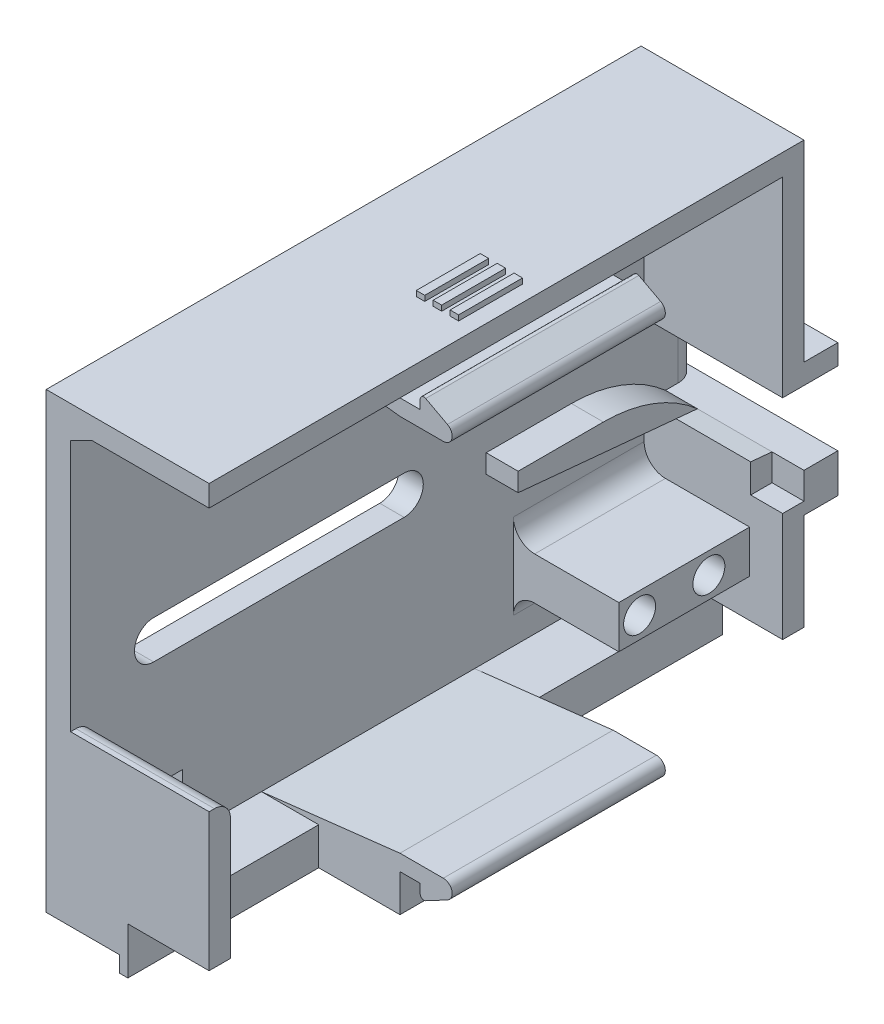
from build123d import *

# Parameters (mm, degrees)
MAIN_EXTRUDE_DEPTH            = 2.2875
WALLS_START                   = 2.2875
WALLS_DEPTH                   = 13
CORNER_SUPPORT_DEPTH          = 2
SKETCH2_R                     = 0.95
SKETCH2_W                     = 2.4
SKETCH2_H                     = 4
SKETCH2_W_2                   = 1
SWITCH_SPACER_DEPTH           = 9.9
ARM_SUPPORT_EXTRUDE_DEPTH     = 3
ARM_SUPPORT_CURVE_DEPTH       = 40.380356778
FILLET4_R                     = 2
FILLET3_R                     = 2
SKETCH2_5_R                   = 0.95
SWITCH_MOUNT_HOLES_DEPTH      = 40.380356889
SKETCH35_R                    = 1.5
SWITCH_MOUNT_EXIT_HOLES_DEPTH = 3
SKETCH4_W                     = 8.5
SKETCH4_H                     = 5.5
WIRE_HOLE_DEPTH               = 40.380356889
SKETCH25_W                    = 6
SKETCH25_H                    = 1.35
FEMALE_SNAP_DEPTH             = 10.125
SKETCH5_W                     = 30
SKETCH5_H                     = 12.75
SERVO_HOLE_DEPTH              = 40.380356889
MAGNET_EXTRUDE_1_DEPTH        = 7.625
MAGNET_EXTRUDE_1_DEPTH_BACK   = 8.2
SKETCH30_W                    = 15.7875
SKETCH30_H                    = 0.9
SKETCH30_W_2                  = 17.7875
SKETCH30_H_2                  = 1.5
SKETCH29_R                    = 7.7
MAGNET_HOLE_DEPTH             = 2.1
SKETCH31_R                    = 5.5
MAGNET_THRU_HOLE_DEPTH        = 58.632218961
SKETCH39_W                    = 3.175
SKETCH39_H                    = 12.55
CUT_EXTRUDE1_DEPTH            = 45.416158798
CUT_EXTRUDE2_DEPTH            = 42.895144408
BOSS_EXTRUDE2_DEPTH           = 10
MIRROR1_OUTLINE_W             = 42.5
MIRROR1_OUTLINE_H             = 55.825
MIRROR1_OUTLINE_W_2           = 5.5
MIRROR1_OUTLINE_H_2           = 8.5
MIRROR1_OUTLINE_R             = 0.95
MIRROR1_DEPTH                 = 2.2875
MIRROR1_START                 = 2.2875
MIRROR1_2_DEPTH               = 13
MIRROR1_3_OUTLINE_W           = 4
MIRROR1_3_OUTLINE_H           = 12.275
MIRROR1_3_OUTLINE_R           = 1.5
MIRROR1_3_DEPTH               = 9.9
MIRROR1_4_OUTLINE_R           = 1.5
MIRROR1_4_OUTLINE_R_2         = 0.95
MIRROR1_4_DEPTH               = 3
MIRROR1_START_2               = 5.2875
MIRROR1_5_OUTLINE_R           = 1.5
MIRROR1_5_OUTLINE_R_2         = 0.95
MIRROR1_5_DEPTH               = 3.9
MIRROR1_START_3               = 12.1875
MIRROR1_6_DEPTH               = 0.1
MIRROR1_START_4               = -84.325
MIRROR1_7_DEPTH               = 14.275
MIRROR1_START_5               = -30.5
MIRROR1_8_DEPTH               = 2
SKETCH6_W                     = 59
SKETCH6_H                     = 44
MIRROR_CUT_DEPTH              = 91.295353043
MALE_SNAP_DEPTH               = 10
SKETCH34_W                    = 55.825
SKETCH34_H                    = 1.5
MAGNET_EXTRUDE_DEPTH          = 8.4
SKETCH34_5_W                  = 15.9125
SKETCH34_5_H                  = 0.9
SKETCH34_5_W_2                = 17.9125
SKETCH34_5_H_2                = 1.5
MAGNET_BOTTOM_CUT_DEPTH       = 7.625
SKETCH36_W                    = 0.79375
SKETCH36_H                    = 6
BOSS_EXTRUDE1_DEPTH           = 0.5
BOSS_EXTRUDE5_DEPTH           = 3.175
FILLET7_R                     = 2


with BuildPart() as part:
    # Sketch1 → Main Extrude (new body)
    with BuildSketch(Plane(origin=(0, 0, 0), x_dir=(0, 0, -1), z_dir=(1, 0, 0))):
        Polygon((-30.5, -9.35), (-27.325, -9.35), (-27.325, -21.25), (28.5, -21.25), (28.5, 21.25), (-27.325, 21.25), (-27.325, 3.2), (-30.5, 3.2), align=None)
        with BuildLine():
            Line((20.7, -3.65), (-2.8, -3.65))
            ThreePointArc((-2.8, -3.65), (-4.6, -1.85), (-2.8, -0.05))
            Line((-2.8, -0.05), (20.7, -0.05))
            ThreePointArc((20.7, -0.05), (22.5, -1.85), (20.7, -3.65))
        make_face(mode=Mode.SUBTRACT)
    extrude(amount=MAIN_EXTRUDE_DEPTH)

    # Sketch1<3> → Walls (add)
    with BuildSketch(Plane(origin=(0, 0, 0), x_dir=(0, 0, -1), z_dir=(1, 0, 0)).offset(WALLS_START)):
        Polygon((-25.325, 19.25), (28.5, 19.25), (28.5, 21.25), (-27.325, 21.25), (-27.325, 3.2), (-30.5, 3.2), (-30.5, 1.3), (-25.325, 1.3), align=None)
        with BuildLine():
            Line((28.5, -5.425), (28, -5.425))
            ThreePointArc((28, -5.425), (26.939339828, -5.864339828), (26.5, -6.925))
            Line((26.5, -6.925), (26.5, -19.25))
            Line((26.5, -19.25), (-25.325, -19.25))
            Line((-25.325, -19.25), (-25.325, -8.1))
            Line((-25.325, -8.1), (-28.5, -8.1))
            Line((-28.5, -8.1), (-28.5, -4.45))
            Line((-28.5, -4.45), (-30.5, -4.45))
            Line((-30.5, -4.45), (-30.5, -9.35))
            Line((-30.5, -9.35), (-27.325, -9.35))
            Line((-27.325, -9.35), (-27.325, -21.25))
            Line((-27.325, -21.25), (28.5, -21.25))
            Line((28.5, -21.25), (28.5, -5.425))
        make_face()
    extrude(amount=WALLS_DEPTH)

    # Sketch22 → Corner Support (add)
    with BuildSketch(Plane(origin=(0, 0, -28.5), x_dir=(-1, 0, 0), z_dir=(0, 0, -1))):
        Polygon((-4.2875, 19.25), (-2.2875, 18.25), (-2.2875, 19.25), align=None)
    extrude(amount=-CORNER_SUPPORT_DEPTH)

    # Sketch2 → Switch Spacer (add)
    # profile 1 of 7: a face of its own
    with BuildSketch(Plane(origin=(2.2875, 0, 0), x_dir=(0, 0, -1), z_dir=(1, 0, 0))):
        Polygon((-14.05, -10.75), (-17.05, -10.75), (-17.05, -14.75), (-14.05, -14.75), (-14.05, -12.75), align=None)
        with Locations((-15, -12.75)):
            Circle(SKETCH2_R, mode=Mode.SUBTRACT)
    # profile 2 of 7: a face of its own
    with BuildSketch(Plane(origin=(2.2875, 0, 0), x_dir=(0, 0, -1), z_dir=(1, 0, 0))):
        with Locations((-15, -12.75)):
            Circle(SKETCH2_R)
    # profile 3 of 7: a face of its own
    with BuildSketch(Plane(origin=(2.2875, 0, 0), x_dir=(0, 0, -1), z_dir=(1, 0, 0))):
        Polygon((-19.45, -10.75), (-22.45, -10.75), (-22.45, -12.75), (-22.45, -14.75), (-19.45, -14.75), align=None)
        with BuildLine():
            ThreePointArc((-20.55, -12.75), (-21.5, -13.7), (-22.45, -12.75))
            ThreePointArc((-22.45, -12.75), (-21.5, -11.8), (-20.55, -12.75))
        make_face(mode=Mode.SUBTRACT)
    # profile 4 of 7: a face of its own
    with BuildSketch(Plane(origin=(2.2875, 0, 0), x_dir=(0, 0, -1), z_dir=(1, 0, 0))):
        with Locations((-21.5, -12.75)):
            Circle(SKETCH2_R)
    # profile 5 of 7: a face of its own
    with BuildSketch(Plane(origin=(2.2875, 0, 0), x_dir=(0, 0, -1), z_dir=(1, 0, 0))):
        Polygon((-22.45, -12.75), (-22.45, -10.75), (-25.325, -10.75), (-25.325, -14.75), (-22.45, -14.75), align=None)
    # profile 6 of 7: a face of its own
    with BuildSketch(Plane(origin=(2.2875, 0, 0), x_dir=(0, 0, -1), z_dir=(1, 0, 0))):
        with Locations((-18.25, -12.75)):
            Rectangle(SKETCH2_W, SKETCH2_H)
    # profile 7 of 7: a face of its own
    with BuildSketch(Plane(origin=(2.2875, 0, 0), x_dir=(0, 0, -1), z_dir=(1, 0, 0))):
        with Locations((-13.55, -12.75)):
            Rectangle(SKETCH2_W_2, SKETCH2_H)
    extrude(amount=SWITCH_SPACER_DEPTH)

    # Sketch3 → Arm Support Extrude (add)
    with BuildSketch(Plane(origin=(2.2875, 0, 0), x_dir=(0, 0, -1), z_dir=(1, 0, 0))):
        with BuildLine():
            Line((-18.5, -2.25), (-10.5, -2.25))
            Line((-10.5, -2.25), (-10.5, -4))
            Line((-10.5, -4), (-28.5, -5.7))
            Line((-28.5, -5.7), (-30.5, -5.7))
            ThreePointArc((-30.5, -5.7), (-24.743046131, -3.129622151), (-18.5, -2.25))
        make_face()
    extrude(amount=ARM_SUPPORT_EXTRUDE_DEPTH)

    # Sketch7 → Arm Support Curve (cut, through all)
    with BuildSketch(Plane(origin=(2.2875, 0, 0), x_dir=(0, 0, -1), z_dir=(1, 0, 0))):
        with BuildLine():
            Line((-28.5, -4.583410824), (-28.5, -4.45))
            Line((-28.5, -4.45), (-30.5, -4.45))
            Line((-30.5, -4.45), (-30.5, -5.7))
            ThreePointArc((-30.5, -5.7), (-29.627655409, -5.180138898), (-28.73283292, -4.7))
            ThreePointArc((-28.73283292, -4.7), (-28.616584416, -4.641369997), (-28.5, -4.583410824))
        make_face()
    extrude(amount=ARM_SUPPORT_CURVE_DEPTH, mode=Mode.SUBTRACT)

    # Fillet4
    fillet4_edges = [part.edges().sort_by_distance(p)[0] for p in [
        (2.2875, -2.2, 30.5),
    ]]
    fillet(fillet4_edges, radius=FILLET4_R)

    # Fillet3
    fillet3_edges = [part.edges().sort_by_distance(p)[0] for p in [
        (2.2875, -14.75, 19.1875),
        (2.2875, -10.75, 19.1875),
    ]]
    fillet(fillet3_edges, radius=FILLET3_R)

    # Sketch2<5> → Switch Mount Holes (cut, symmetric)
    with BuildSketch(Plane(origin=(2.2875, 0, 0), x_dir=(0, 0, -1), z_dir=(1, 0, 0))):
        with Locations((-21.5, -12.75)):
            Circle(SKETCH2_5_R)
        with Locations((-15, -12.75)):
            Circle(SKETCH2_5_R)
    extrude(amount=SWITCH_MOUNT_HOLES_DEPTH, both=True, mode=Mode.SUBTRACT)

    # Sketch35 → Switch Mount Exit Holes (cut)
    with BuildSketch(Plane(origin=(12.1875, 0, 0), x_dir=(0, 0, -1), z_dir=(1, 0, 0))):
        with Locations((-21.5, -12.75)):
            Circle(SKETCH35_R)
        with Locations((-15, -12.75)):
            Circle(SKETCH35_R)
    extrude(amount=-SWITCH_MOUNT_EXIT_HOLES_DEPTH, mode=Mode.SUBTRACT)

    # Sketch4 → Wire Hole (cut, through all)
    with BuildSketch(Plane(origin=(2.2875, 0, 0), x_dir=(0, 0, -1), z_dir=(1, 0, 0))):
        with Locations((22.25, -16.5)):
            Rectangle(SKETCH4_W, SKETCH4_H)
    extrude(amount=-WIRE_HOLE_DEPTH, mode=Mode.SUBTRACT)

    # Sketch25 → Female Snap (cut, symmetric)
    with BuildSketch(Plane(origin=(0, 0, -0.5875), x_dir=(-1, 0, 0), z_dir=(0, 0, -1))):
        with Locations((-11.0375, -19.925)):
            Rectangle(SKETCH25_W, SKETCH25_H)
        Polygon((-15.2875, -19.25), (-15.2875, -19.91463679), (-14.0375, -19.25), align=None)
        with Locations((-11.0375, 19.925)):
            Rectangle(SKETCH25_W, SKETCH25_H)
        Polygon((-15.2875, 19.91463679), (-15.2875, 19.25), (-14.0375, 19.25), align=None)
    extrude(amount=FEMALE_SNAP_DEPTH, both=True, mode=Mode.SUBTRACT)

    # Sketch5 → Servo Hole (cut, through all)
    with BuildSketch(Plane(origin=(2.2875, 0, 0), x_dir=(0, 0, -1), z_dir=(1, 0, 0))):
        with Locations((7.35, 9.675)):
            Rectangle(SKETCH5_W, SKETCH5_H)
        with BuildLine():
            Line((-8.75, 10.675), (-8.75, 8.675))
            ThreePointArc((-8.75, 8.675), (-10.3, 7.125), (-11.85, 8.675))
            Line((-11.85, 8.675), (-11.85, 10.675))
            ThreePointArc((-11.85, 10.675), (-10.3, 12.225), (-8.75, 10.675))
        make_face()
        with BuildLine():
            Line((26.55, 10.675), (26.55, 8.675))
            ThreePointArc((26.55, 8.675), (25, 7.125), (23.45, 8.675))
            Line((23.45, 8.675), (23.45, 10.675))
            ThreePointArc((23.45, 10.675), (25, 12.225), (26.55, 10.675))
        make_face()
    extrude(amount=-SERVO_HOLE_DEPTH, mode=Mode.SUBTRACT)

    # Sketch30 → Magnet Extrude 1 (add, two sides: drawn at the far end of the back side and taken through both)
    with BuildSketch(Plane(origin=(15.2875, 0, 0), x_dir=(0, 0, -1), z_dir=(1, 0, 0)).offset(-MAGNET_EXTRUDE_1_DEPTH_BACK)):
        Polygon((-27.325, -18.35), (-27.325, -21.25), (-9.5375, -21.25), (-9.5375, -19.91463679), (-9.5375, -19.25), (-25.325, -19.25), (-25.325, -18.35), align=None)
        with Locations((-17.43125, -18.8)):
            Rectangle(SKETCH30_W, SKETCH30_H)
        with Locations((19.60625, -22)):
            Rectangle(SKETCH30_W_2, SKETCH30_H_2)
        Polygon((10.7125, -19.91463679), (10.7125, -21.25), (28.5, -21.25), (28.5, -18.35), (26.5, -18.35), (26.5, -19.25), (10.7125, -19.25), align=None)
        with Locations((-18.43125, -22)):
            Rectangle(SKETCH30_W_2, SKETCH30_H_2)
        with Locations((18.60625, -18.8)):
            Rectangle(SKETCH30_W, SKETCH30_H)
    extrude(amount=MAGNET_EXTRUDE_1_DEPTH + MAGNET_EXTRUDE_1_DEPTH_BACK)

    # Sketch29 → Magnet Hole (cut)
    with BuildSketch(Plane(origin=(0, -21.95, 0), x_dir=(1, 0, 0), z_dir=(0, 1, 0))):
        with Locations((15.2875, -17.625)):
            Circle(SKETCH29_R)
        with BuildLine():
            ThreePointArc((22.9125, -18.697089082), (20.338980677, -23.436414885), (15.2875, -25.325))
            Line((15.2875, -25.325), (22.9125, -25.325))
            Line((22.9125, -25.325), (22.9125, -18.697089082))
        make_face()
        with BuildLine():
            Line((22.9125, -9.925), (15.2875, -9.925))
            ThreePointArc((15.2875, -9.925), (20.338980677, -11.813585115), (22.9125, -16.552910918))
            Line((22.9125, -16.552910918), (22.9125, -9.925))
        make_face()
        with Locations((15.2875, 19.4)):
            Circle(SKETCH29_R)
        with BuildLine():
            ThreePointArc((22.9125, 18.327910918), (20.338980677, 13.588585115), (15.2875, 11.7))
            Line((15.2875, 11.7), (22.9125, 11.7))
            Line((22.9125, 11.7), (22.9125, 18.327910918))
        make_face()
        with BuildLine():
            Line((22.9125, 27.1), (15.2875, 27.1))
            ThreePointArc((15.2875, 27.1), (20.338980677, 25.211414885), (22.9125, 20.472089082))
            Line((22.9125, 20.472089082), (22.9125, 27.1))
        make_face()
        with BuildLine():
            ThreePointArc((22.9875, -17.625), (22.968727116, -17.087645368), (22.9125, -16.552910918))
            Line((22.9125, -16.552910918), (22.9125, -18.697089082))
            ThreePointArc((22.9125, -18.697089082), (22.968727116, -18.162354632), (22.9875, -17.625))
        make_face()
        with BuildLine():
            Line((22.9125, 20.472089082), (22.9125, 18.327910918))
            ThreePointArc((22.9125, 18.327910918), (22.968727116, 18.862645368), (22.9875, 19.4))
            ThreePointArc((22.9875, 19.4), (22.968727116, 19.937354632), (22.9125, 20.472089082))
        make_face()
    extrude(amount=MAGNET_HOLE_DEPTH, mode=Mode.SUBTRACT)

    # Sketch31 → Magnet Thru Hole (cut, through all)
    with BuildSketch(Plane.XZ.offset(21.95)):
        with Locations((15.2875, 17.625)):
            Circle(SKETCH31_R)
        with BuildLine():
            Line((22.9125, 23.125), (15.2875, 23.125))
            ThreePointArc((15.2875, 23.125), (19.176587297, 21.514087297), (20.7875, 17.625))
            ThreePointArc((20.7875, 17.625), (19.176587297, 13.735912703), (15.2875, 12.125))
            Line((15.2875, 12.125), (22.9125, 12.125))
            Line((22.9125, 12.125), (22.9125, 23.125))
        make_face()
        with Locations((15.2875, -19.4)):
            Circle(SKETCH31_R)
        with BuildLine():
            Line((22.9125, -13.9), (15.2875, -13.9))
            ThreePointArc((15.2875, -13.9), (19.176587297, -15.510912703), (20.7875, -19.4))
            ThreePointArc((20.7875, -19.4), (19.176587297, -23.289087297), (15.2875, -24.9))
            Line((15.2875, -24.9), (22.9125, -24.9))
            Line((22.9125, -24.9), (22.9125, -13.9))
        make_face()
    extrude(amount=MAGNET_THRU_HOLE_DEPTH, mode=Mode.SUBTRACT)

    # Sketch39 → Cut-Extrude1 (cut, through all)
    with BuildSketch(Plane.ZY):
        with Locations((28.9125, -3.075)):
            Rectangle(SKETCH39_W, SKETCH39_H)
    extrude(amount=-CUT_EXTRUDE1_DEPTH, mode=Mode.SUBTRACT)

    # Sketch40 → Cut-Extrude2 (cut, through all)
    with BuildSketch(Plane(origin=(2.2875, 0, 0), x_dir=(0, 0, -1), z_dir=(1, 0, 0))):
        with BuildLine():
            Line((-27.325, -5.589027778), (-27.325, -4.044715402))
            ThreePointArc((-27.325, -4.044715402), (-23.002822125, -2.703224466), (-18.5, -2.25))
            ThreePointArc((-18.5, -2.25), (-23.217778383, -3.112667731), (-27.325, -5.589027778))
        make_face()
    extrude(amount=CUT_EXTRUDE2_DEPTH, mode=Mode.SUBTRACT)

    # Sketch41 → Boss-Extrude2 (add)
    with BuildSketch(Plane(origin=(2.2875, 0, 0), x_dir=(0, 0, -1), z_dir=(1, 0, 0))):
        Polygon((-25.325, -8.1), (-27.325, -8.1), (-27.325, -5.589027778), (-25.325, -5.400138889), align=None)
    extrude(amount=BOSS_EXTRUDE2_DEPTH)

    # Mirror1: read off the stored shape, not the designer's step
    # Mirror1 outline → Mirror1 (add)
    with BuildSketch(Plane.YZ):
        with Locations((0, -56.4125)):
            Rectangle(MIRROR1_OUTLINE_W, MIRROR1_OUTLINE_H)
        with Locations((-16.5, -34.75)):
            Rectangle(MIRROR1_OUTLINE_W_2, MIRROR1_OUTLINE_H_2, mode=Mode.SUBTRACT)
        with BuildLine():
            ThreePointArc((-0.05, -59.8), (-1.85, -61.6), (-3.65, -59.8))
            Line((-3.65, -59.8), (-3.65, -36.3))
            ThreePointArc((-3.65, -36.3), (-1.85, -34.5), (-0.05, -36.3))
            Line((-0.05, -36.3), (-0.05, -59.8))
        make_face(mode=Mode.SUBTRACT)
        with Locations((-12.75, -72)):
            Circle(MIRROR1_OUTLINE_R, mode=Mode.SUBTRACT)
        with Locations((-12.75, -78.5)):
            Circle(MIRROR1_OUTLINE_R, mode=Mode.SUBTRACT)
    extrude(amount=MIRROR1_DEPTH)

    # Mirror1 2 outline → Mirror1 2 (add)
    with BuildSketch(Plane.YZ.offset(MIRROR1_START)):
        with BuildLine():
            Line((-21.25, -28.5), (-21.25, -84.325))
            Line((-21.25, -84.325), (-8.1, -84.325))
            Line((-8.1, -84.325), (-8.1, -82.325))
            Line((-8.1, -82.325), (-19.25, -82.325))
            Line((-19.25, -82.325), (-19.25, -30.5))
            Line((-19.25, -30.5), (-6.925, -30.5))
            ThreePointArc((-6.925, -30.5), (-5.864339828, -30.060660172), (-5.425, -29))
            Line((-5.425, -29), (-5.425, -28.5))
            Line((-5.425, -28.5), (-21.25, -28.5))
        make_face()
        Polygon((1.3, -82.325), (1.3, -84.325), (21.25, -84.325), (21.25, -28.5), (19.25, -28.5), (19.25, -82.325), align=None)
    extrude(amount=MIRROR1_2_DEPTH)

    # Mirror1 3 outline → Mirror1 3 (add)
    # profile 1 of 2: a face of its own
    with BuildSketch(Plane.YZ.offset(MIRROR1_START)):
        Polygon((-8.1, -82.325), (-8.1, -84.325), (-5.589027778, -84.325), (-5.400138889, -82.325), align=None)
    # profile 2 of 2: a face of its own
    with BuildSketch(Plane.YZ.offset(MIRROR1_START)):
        with Locations((-12.75, -76.1875)):
            Rectangle(MIRROR1_3_OUTLINE_W, MIRROR1_3_OUTLINE_H)
        with Locations((-12.75, -78.5)):
            Circle(MIRROR1_3_OUTLINE_R, mode=Mode.SUBTRACT)
        with Locations((-12.75, -72)):
            Circle(MIRROR1_3_OUTLINE_R, mode=Mode.SUBTRACT)
    extrude(amount=MIRROR1_3_DEPTH)

    # Mirror1 4 outline → Mirror1 4 (add)
    # profile 1 of 3: a face of its own
    with BuildSketch(Plane.YZ.offset(MIRROR1_START)):
        with BuildLine():
            Line((-5.400138889, -82.325), (-5.589027778, -84.325))
            ThreePointArc((-5.589027778, -84.325), (-3.112667731, -80.217778383), (-2.25, -75.5))
            Line((-2.25, -75.5), (-2.25, -67.5))
            Line((-2.25, -67.5), (-4, -67.5))
            Line((-4, -67.5), (-5.400138889, -82.325))
        make_face()
    # profile 2 of 3: a face of its own
    with BuildSketch(Plane.YZ.offset(MIRROR1_START)):
        with Locations((-12.75, -78.5)):
            Circle(MIRROR1_4_OUTLINE_R)
        with Locations((-12.75, -78.5)):
            Circle(MIRROR1_4_OUTLINE_R_2, mode=Mode.SUBTRACT)
    # profile 3 of 3: a face of its own
    with BuildSketch(Plane.YZ.offset(MIRROR1_START)):
        with Locations((-12.75, -72)):
            Circle(MIRROR1_4_OUTLINE_R)
        with Locations((-12.75, -72)):
            Circle(MIRROR1_4_OUTLINE_R_2, mode=Mode.SUBTRACT)
    extrude(amount=MIRROR1_4_DEPTH)

    # Mirror1 5 outline → Mirror1 5 (add)
    # profile 1 of 2: a face of its own
    with BuildSketch(Plane.YZ.offset(MIRROR1_START_2)):
        with Locations((-12.75, -78.5)):
            Circle(MIRROR1_5_OUTLINE_R)
        with Locations((-12.75, -78.5)):
            Circle(MIRROR1_5_OUTLINE_R_2, mode=Mode.SUBTRACT)
    # profile 2 of 2: a face of its own
    with BuildSketch(Plane.YZ.offset(MIRROR1_START_2)):
        with Locations((-12.75, -72)):
            Circle(MIRROR1_5_OUTLINE_R)
        with Locations((-12.75, -72)):
            Circle(MIRROR1_5_OUTLINE_R_2, mode=Mode.SUBTRACT)
    extrude(amount=MIRROR1_5_DEPTH)

    # Mirror1 6 outline → Mirror1 6 (add)
    with BuildSketch(Plane.YZ.offset(MIRROR1_START_3)):
        Polygon((-8.1, -82.325), (-8.1, -84.325), (-5.589027778, -84.325), (-5.400138889, -82.325), align=None)
    extrude(amount=MIRROR1_6_DEPTH)

    # Mirror1 7 outline → Mirror1 7 (add)
    with BuildSketch(Plane.XY.offset(MIRROR1_START_4)):
        with BuildLine():
            Line((4.2875, -14.75), (2.2875, -14.75))
            Line((2.2875, -14.75), (2.2875, -16.75))
            ThreePointArc((2.2875, -16.75), (2.873286438, -15.335786438), (4.2875, -14.75))
        make_face()
        with BuildLine():
            ThreePointArc((4.2875, -10.75), (2.873286438, -10.164213562), (2.2875, -8.75))
            Line((2.2875, -8.75), (2.2875, -10.75))
            Line((2.2875, -10.75), (4.2875, -10.75))
        make_face()
    extrude(amount=MIRROR1_7_DEPTH)

    # Mirror1 8 outline → Mirror1 8 (add)
    with BuildSketch(Plane.XY.offset(MIRROR1_START_5)):
        Polygon((2.2875, 19.25), (2.2875, 18.25), (4.2875, 19.25), align=None)
    extrude(amount=MIRROR1_8_DEPTH)

    # Sketch6 → Mirror Cut (cut, through all)
    with BuildSketch(Plane.ZY):
        with Locations((1, -0.75)):
            Rectangle(SKETCH6_W, SKETCH6_H)
    extrude(amount=-MIRROR_CUT_DEPTH, mode=Mode.SUBTRACT)

    # Sketch24 → Male Snap (add, symmetric)
    with BuildSketch(Plane.XY.offset(-56.4125)):
        with BuildLine():
            Line((2.2875, -19.25), (17.1875, -19.25))
            Line((17.1875, -19.25), (17.1875, -20.1))
            ThreePointArc((17.1875, -20.1), (17.357231833, -20.4), (17.70180038, -20.409022845))
            Line((17.70180038, -20.409022845), (19.744298548, -19.323007305))
            ThreePointArc((19.744298548, -19.323007305), (20.162685162, -18.383295584), (19.352103778, -17.75))
            Line((19.352103778, -17.75), (15.2875, -17.75))
            Line((15.2875, -17.75), (2.2875, -19.25))
        make_face()
        with BuildLine():
            Line((17.70180038, 20.409022845), (19.744298548, 19.323007305))
            ThreePointArc((19.744298548, 19.323007305), (20.162685162, 18.383295584), (19.352103778, 17.75))
            Line((19.352103778, 17.75), (15.2875, 17.75))
            Line((15.2875, 17.75), (2.2875, 19.25))
            Line((2.2875, 19.25), (17.1875, 19.25))
            Line((17.1875, 19.25), (17.1875, 20.1))
            ThreePointArc((17.1875, 20.1), (17.357231833, 20.4), (17.70180038, 20.409022845))
        make_face()
    extrude(amount=MALE_SNAP_DEPTH, both=True)

    # Sketch34 → Magnet Extrude (add)
    with BuildSketch(Plane(origin=(15.2875, 0, 0), x_dir=(0, 0, -1), z_dir=(1, 0, 0))):
        with Locations((56.4125, -22)):
            Rectangle(SKETCH34_W, SKETCH34_H)
    extrude(amount=-MAGNET_EXTRUDE_DEPTH)

    # Sketch34<5> → Magnet Bottom Cut (cut)
    with BuildSketch(Plane(origin=(15.2875, 0, 0), x_dir=(0, 0, -1), z_dir=(1, 0, 0))):
        with Locations((38.45625, -18.8)):
            Rectangle(SKETCH34_5_W, SKETCH34_5_H)
        Polygon((66.4125, -19.25), (66.4125, -21.25), (84.325, -21.25), (84.325, -18.35), (82.325, -18.35), (82.325, -19.25), align=None)
        with Locations((74.36875, -18.8)):
            Rectangle(SKETCH34_5_W, SKETCH34_5_H)
        Polygon((28.5, -18.35), (28.5, -21.25), (46.4125, -21.25), (46.4125, -19.25), (30.5, -19.25), (30.5, -18.35), align=None)
        with Locations((37.45625, -22)):
            Rectangle(SKETCH34_5_W_2, SKETCH34_5_H_2)
        with Locations((75.36875, -22)):
            Rectangle(SKETCH34_5_W_2, SKETCH34_5_H_2)
    extrude(amount=-MAGNET_BOTTOM_CUT_DEPTH, mode=Mode.SUBTRACT)

    # Sketch36 → Boss-Extrude1 (add)
    with BuildSketch(Plane(origin=(0, 21.25, 0), x_dir=(1, 0, 0), z_dir=(0, 1, 0))):
        with Locations((13.390625, 56.4125)):
            Rectangle(SKETCH36_W, SKETCH36_H)
        with Locations((11.803125, 56.4125)):
            Rectangle(SKETCH36_W, SKETCH36_H)
        with Locations((10.215625, 56.4125)):
            Rectangle(SKETCH36_W, SKETCH36_H)
    extrude(amount=BOSS_EXTRUDE1_DEPTH)

    # Sketch44 → Boss-Extrude5 (add)
    with BuildSketch(Plane(origin=(0, 0, -84.325), x_dir=(-1, 0, 0), z_dir=(0, 0, -1))):
        Polygon((-15.2875, 1.3), (-15.2875, 3.2), (0, 3.2), (0, -9.239027778), (-15.2875, -9.239027778), (-15.2875, -5.589027778), (-2.2875, -5.589027778), (-2.2875, 1.3), align=None)
    extrude(amount=BOSS_EXTRUDE5_DEPTH)

    # Fillet7
    fillet7_edges = [part.edges().sort_by_distance(p)[0] for p in [
        (2.2875, -2.144513889, -87.5),
    ]]
    fillet(fillet7_edges, radius=FILLET7_R)


solid = part.part
